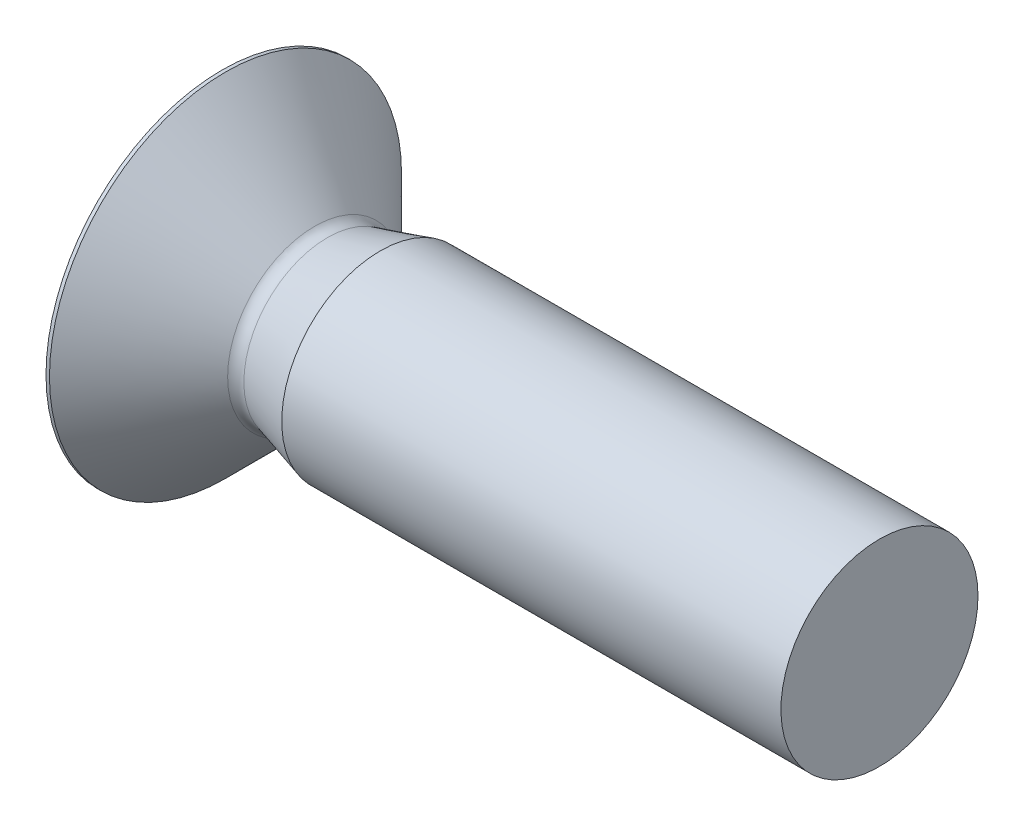
from build123d import *

# Parameters (mm, degrees)
SKETCH1_R           = 1.5
BASEBODY_DEPTH      = 10
BASETOP_FACE_RADIUS = 2.723673019
BASETOP_HEIGHT      = 0.28
SKETCH5_W           = 4
SKETCH5_H           = 2
CROSSRECESS_DEPTH   = 1.4
FILLET1_R           = 0.2
DRAFT3_ANGLE        = -10


# Read off the part's stored shape, not the designer's step: Neck, BaseHead
with BuildPart() as part:
    # Sketch1 → BaseBody (new body)
    with BuildSketch(Plane(origin=(0, 0, 0), x_dir=(0, 0, -1), z_dir=(1, 0, 0))):
        Circle(SKETCH1_R)
    extrude(amount=BASEBODY_DEPTH)

    # Neck outline → Neck (revolve, cut)
    with BuildSketch(Plane.YX):
        Polygon((1.5, 2.4), (1.076815246, 0), (1.5, 0), align=None)
    revolve(axis=Axis((0, 0, 0), (1, 0, 0)), mode=Mode.SUBTRACT)

    # BaseHead outline → BaseHead (revolve)
    with BuildSketch(Plane.YX):
        Polygon((0, 0), (2.723673019, 0), (1.323673019, 1.4), (0, 1.4), align=None)
    revolve(axis=Axis((0, 0, 0), (1, 0, 0)))

    # BaseTop: a dome of height H over a round flat face of radius A is a cap of a sphere of radius (A * A + H * H) / (2 * H)
    basetop_r = (BASETOP_FACE_RADIUS * BASETOP_FACE_RADIUS + BASETOP_HEIGHT * BASETOP_HEIGHT) / (2 * BASETOP_HEIGHT)
    basetop_base = Plane((0, 0, 0), z_dir=(-1, 0, 0))
    with Locations(basetop_base.offset(BASETOP_HEIGHT - basetop_r)):
        basetop_ball = Sphere(basetop_r, mode=Mode.PRIVATE)
    add(split(basetop_ball, bisect_by=basetop_base, keep=Keep.TOP, mode=Mode.PRIVATE))

    # Sketch5 → Cut-Revolve1 (revolve, cut)
    with BuildSketch(Plane.XY):
        with Locations((0, 3.68)):
            Rectangle(SKETCH5_W, SKETCH5_H)
    revolve(axis=Axis((10, 0, 0), (-1, 0, 0)), mode=Mode.SUBTRACT)

    # Sketch7 → CrossRecess (cut)
    with BuildSketch(Plane(origin=(-0.28, 0, 0), x_dir=(0, 0, -1), z_dir=(1, 0, 0))):
        Polygon((0.27, -0.27), (0.27, -1.35), (-0.27, -1.35), (-0.27, -0.27), (-1.35, -0.27), (-1.35, 0.27), (-0.27, 0.27), (-0.27, 1.35), (0.27, 1.35), (0.27, 0.27), (1.35, 0.27), (1.35, -0.27), align=None)
    extrude(amount=CROSSRECESS_DEPTH, mode=Mode.SUBTRACT)

    # Fillet1
    fillet1_edges = [part.edges().sort_by_distance(p)[0] for p in [
        (0.422723318, 0.27, 0.27),
        (0.422723318, -0.27, 0.27),
        (0.422723318, -0.27, -0.27),
        (0.422723318, 0.27, -0.27),
    ]]
    fillet(fillet1_edges, radius=FILLET1_R)

    # Draft3
    draft3_faces = [part.faces().sort_by_distance(p)[0] for p in [
        (0.454577412, -1.35, 0),
        (0.454577412, 0, 1.35),
        (0.454577412, 0, -1.35),
        (0.454577412, 1.35, 0),
    ]]
    draft(draft3_faces, Plane(origin=(-0.28, 0, 0), x_dir=(0, 0, 1), z_dir=(1, 0, 0)), DRAFT3_ANGLE)

    # Sketch8 → Cut-Revolve2 (revolve, cut)
    with BuildSketch(Plane.XY, mode=Mode.PRIVATE) as cut_revolve2_sk:
        with BuildLine():
            Line((1.4, 1.323673019), (0.043673019, 2.68))
            Line((0.043673019, 2.68), (2.4, 2.68))
            Line((2.4, 2.68), (2.4, 1.5))
            Line((2.4, 1.5), (1.595834298, 1.272638584))
            ThreePointArc((1.595834298, 1.272638584), (1.490985809, 1.271558189), (1.4, 1.323673019))
        make_face()
    revolve(cut_revolve2_sk.sketch.rotate(Axis((0, 0, 0), (1, 0, 0)), 90), axis=Axis((0, 0, 0), (1, 0, 0)), mode=Mode.SUBTRACT)


solid = part.part
